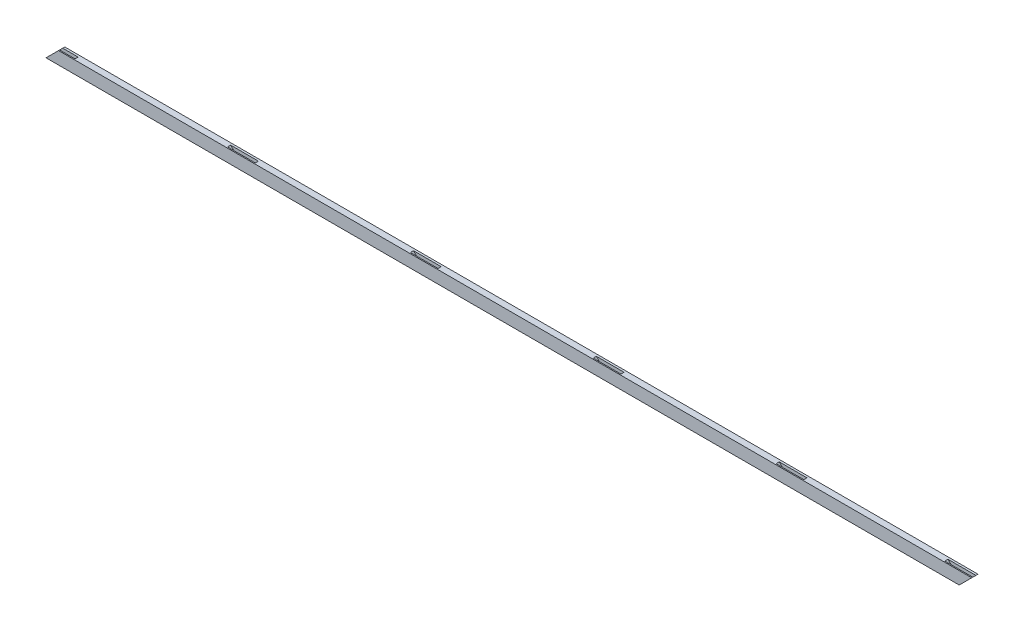
from build123d import *

# Parameters (mm, degrees)
EXTRUDE_1_DEPTH        = 12
SKETCH_2_W             = 40
SKETCH_2_H             = 6
CUT_EXTRUDE_1_DEPTH    = 6.5
DRAFT_1_ANGLE          = 45
MIRROR_START           = 4
MIRROR_1_DEPTH         = 6
PATTERN_START          = 4
PATTERN_LINEAR_2_DEPTH = 6
CUT_EXTRUDE_START      = -2
CUT_EXTRUDE_2_DEPTH    = 6


# Read off the part's stored shape, not the designer's step: 镜向1, 阵列(线性)2
with BuildPart() as part:
    # 草图1 → 凸台-拉伸1 (new body)
    with BuildSketch(Plane.XY):
        Polygon((-12, -12), (12, 12), (1760, 12), (1736, -12), align=None)
    extrude(amount=EXTRUDE_1_DEPTH)

    # 草图2 → 切除-拉伸1 (cut)
    with BuildSketch(Plane.XZ.offset(12)):
        with Locations((1410, 7)):
            Rectangle(SKETCH_2_W, SKETCH_2_H)
    extrude(amount=-CUT_EXTRUDE_1_DEPTH, mode=Mode.SUBTRACT)

    # 拔模1
    draft_1_faces = [part.faces().sort_by_distance(p)[0] for p in [
        (1430, -8.75, 7),
        (1390, -8.75, 7),
    ]]
    draft(draft_1_faces, Plane(origin=(0, -5.5, 0), x_dir=(-1, 0, 0), z_dir=(0, -1, 0)), DRAFT_1_ANGLE)

    # 镜向1 outline → 镜向1 (cut)
    with BuildSketch(Plane.XY.offset(MIRROR_START)):
        Polygon((1390, 5.5), (1430, 5.5), (1436.5, 12), (1383.5, 12), align=None)
    extrude(amount=MIRROR_1_DEPTH, mode=Mode.SUBTRACT)

    # 阵列(线性)2 outline → 阵列(线性)2 (cut)
    with BuildSketch(Plane.XY.offset(PATTERN_START)):
        Polygon((1086.5, 12), (1033.5, 12), (1040, 5.5), (1080, 5.5), align=None)
        Polygon((736.5, 12), (683.5, 12), (690, 5.5), (730, 5.5), align=None)
        Polygon((333.5, 12), (340, 5.5), (380, 5.5), (386.5, 12), align=None)
        Polygon((1040, -5.5), (1033.5, -12), (1086.5, -12), (1080, -5.5), align=None)
        Polygon((690, -5.5), (683.5, -12), (736.5, -12), (730, -5.5), align=None)
        Polygon((340, -5.5), (333.5, -12), (386.5, -12), (380, -5.5), align=None)
    extrude(amount=PATTERN_LINEAR_2_DEPTH, mode=Mode.SUBTRACT)

    # 草图3 → 切除-拉伸2 (cut)
    with BuildSketch(Plane.XY.offset(12).offset(CUT_EXTRUDE_START)):
        Polygon((1706.5, 12), (1713, 5.5), (1753.5, 5.5), (1760, 12), align=None)
        Polygon((1706.5, -12), (1713, -5.5), (1742.5, -5.5), (1736, -12), align=None)
        Polygon((12, 12), (5.5, 5.5), (35, 5.5), (41.5, 12), align=None)
        Polygon((41.5, -12), (35, -5.5), (-5.5, -5.5), (-12, -12), align=None)
    extrude(amount=-CUT_EXTRUDE_2_DEPTH, mode=Mode.SUBTRACT)


solid = part.part
